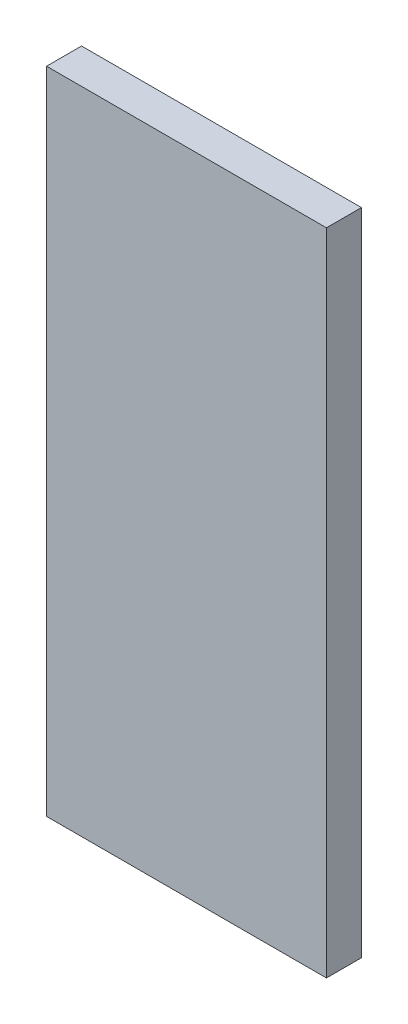
from build123d import *

# Parameters (mm, degrees)
IZIM1_W            = 280
IZIM1_H            = 650
TABAN_FLAN_1_DEPTH = 35


# Sheet-metal steps are written as plain solids
with BuildPart() as part:
    # Çizim1 → Taban-Flanş1 (new body)
    with BuildSketch(Plane.XY):
        with Locations((140, -325)):
            Rectangle(IZIM1_W, IZIM1_H)
    extrude(amount=-TABAN_FLAN_1_DEPTH)


solid = part.part
